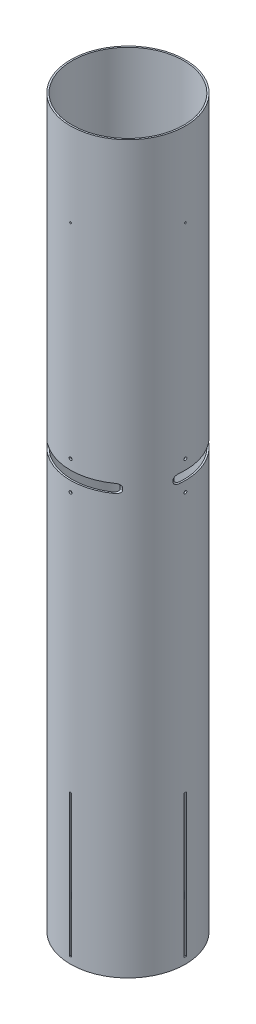
from build123d import *

# Parameters (mm, degrees)
SKETCH1_R                 = 78.359
SKETCH1_R_2               = 76.2
BOSS_EXTRUDE1_DEPTH       = 990.6
FIN_SLOTS_DEPTH           = 997.779125866
CIRPATTERN1_COUNT         = 4
CUT_EXTRUDE2_DEPTH        = 997.779125866
CIRPATTERN2_COUNT         = 4
SKETCH3_R                 = 3.175
CUT_EXTRUDE3_DEPTH        = 997.779125982
SKETCH2_4_R               = 1.0922
SKETCH2_4_R_2             = 1.999996
SHEAR_SCREW_HOLES_DEPTH   = 997.779125982
SHEAR_SCREW_PATTERN_COUNT = 4
CUT_EXTRUDE5_DEPTH        = 997.779125982
CIRPATTERN4_COUNT         = 3


with BuildPart() as part:
    # Sketch1 → Boss-Extrude1 (new body)
    with BuildSketch(Plane(origin=(0, 0, 0), x_dir=(1, 0, 0), z_dir=(0, 1, 0))):
        Circle(SKETCH1_R)
        Circle(SKETCH1_R_2, mode=Mode.SUBTRACT)
    extrude(amount=BOSS_EXTRUDE1_DEPTH)

    # Sketch2 → Fin Slots (cut, through all)
    with BuildSketch(Plane(origin=(0, 0, 0), x_dir=(0, 0, -1), z_dir=(1, 0, 0))):
        Polygon((0, 8.89), (1.5875, 8.89), (1.5875, 203.2), (-1.5875, 203.2), (-1.5875, 8.89), align=None)
    fin_slots = extrude(amount=-FIN_SLOTS_DEPTH, mode=Mode.SUBTRACT)

    # CirPattern1: Fin Slots ×4 about axis
    cirpattern1_axis = Axis((0, 0, 0), (0, 1, 0))
    for i in range(1, CIRPATTERN1_COUNT):
        add(fin_slots.rotate(cirpattern1_axis, i * 360 / CIRPATTERN1_COUNT), mode=Mode.SUBTRACT)

    # Sketch2<3> → Cut-Extrude2 (cut, through all)
    with BuildSketch(Plane(origin=(0, 0, 0), x_dir=(0, 0, -1), z_dir=(1, 0, 0))):
        with BuildLine():
            ThreePointArc((1.999996, 597.4705094), (1.414210734, 598.884720134), (0, 599.4705054))
            ThreePointArc((0, 599.4705054), (-1.414210734, 596.056298666), (1.999996, 597.4705094))
        make_face()
    cut_extrude2 = extrude(amount=-CUT_EXTRUDE2_DEPTH, mode=Mode.SUBTRACT)

    # CirPattern2: Cut-Extrude2 ×4 about axis
    cirpattern2_axis = Axis((0, 990.6, 0), (0, -1, 0))
    for i in range(1, CIRPATTERN2_COUNT):
        add(cut_extrude2.rotate(cirpattern2_axis, i * 360 / CIRPATTERN2_COUNT), mode=Mode.SUBTRACT)

    # Sketch3 → Cut-Extrude3 (cut, through all)
    with BuildSketch(Plane(origin=(0, 0, 0), x_dir=(0.7071067811865477, 0, -0.7071067811865475), z_dir=(0.7071067811865475, 0, 0.7071067811865477))):
        with Locations((0, 127)):
            Circle(SKETCH3_R)
    extrude(amount=-CUT_EXTRUDE3_DEPTH, mode=Mode.SUBTRACT)

    # Sketch2<4> → Shear Screw Holes (cut, through all)
    with BuildSketch(Plane(origin=(0, 0, 0), x_dir=(0, 0, -1), z_dir=(1, 0, 0))):
        with Locations((0, 876.3)):
            Circle(SKETCH2_4_R)
        with Locations((0, 557.77889968)):
            Circle(SKETCH2_4_R_2)
    shear_screw_holes = extrude(amount=-SHEAR_SCREW_HOLES_DEPTH, mode=Mode.SUBTRACT)

    # Shear Screw Pattern: Shear Screw Holes ×4 about axis
    shear_screw_pattern_axis = Axis((0, 990.6, 0), (0, -1, 0))
    for i in range(1, SHEAR_SCREW_PATTERN_COUNT):
        add(shear_screw_holes.rotate(shear_screw_pattern_axis, i * 360 / SHEAR_SCREW_PATTERN_COUNT), mode=Mode.SUBTRACT)

    # Sketch8 → Cut-Extrude5 (cut, symmetric)
    with BuildSketch(Plane(origin=(0, 0, 0), x_dir=(0, 0, -1), z_dir=(1, 0, 0))):
        with BuildLine():
            Line((-78.359, 583.8825), (-63.67526, 583.8825))
            ThreePointArc((-63.67526, 583.8825), (-60.307663955, 582.487596045), (-58.91276, 579.12))
            Line((-58.91276, 579.12), (-58.91276, 576.58))
            ThreePointArc((-58.91276, 576.58), (-60.307663955, 573.212403955), (-63.67526, 571.8175))
            Line((-63.67526, 571.8175), (-78.359, 571.8175))
            Line((-78.359, 571.8175), (-78.359, 583.8825))
        make_face()
    cut_extrude5 = extrude(amount=CUT_EXTRUDE5_DEPTH, both=True, mode=Mode.SUBTRACT)

    # CirPattern4: Cut-Extrude5 ×3 about axis
    cirpattern4_axis = Axis((0, 990.6, 0), (0, -1, 0))
    for i in range(1, CIRPATTERN4_COUNT):
        add(cut_extrude5.rotate(cirpattern4_axis, i * 360 / CIRPATTERN4_COUNT), mode=Mode.SUBTRACT)


solid = part.part
